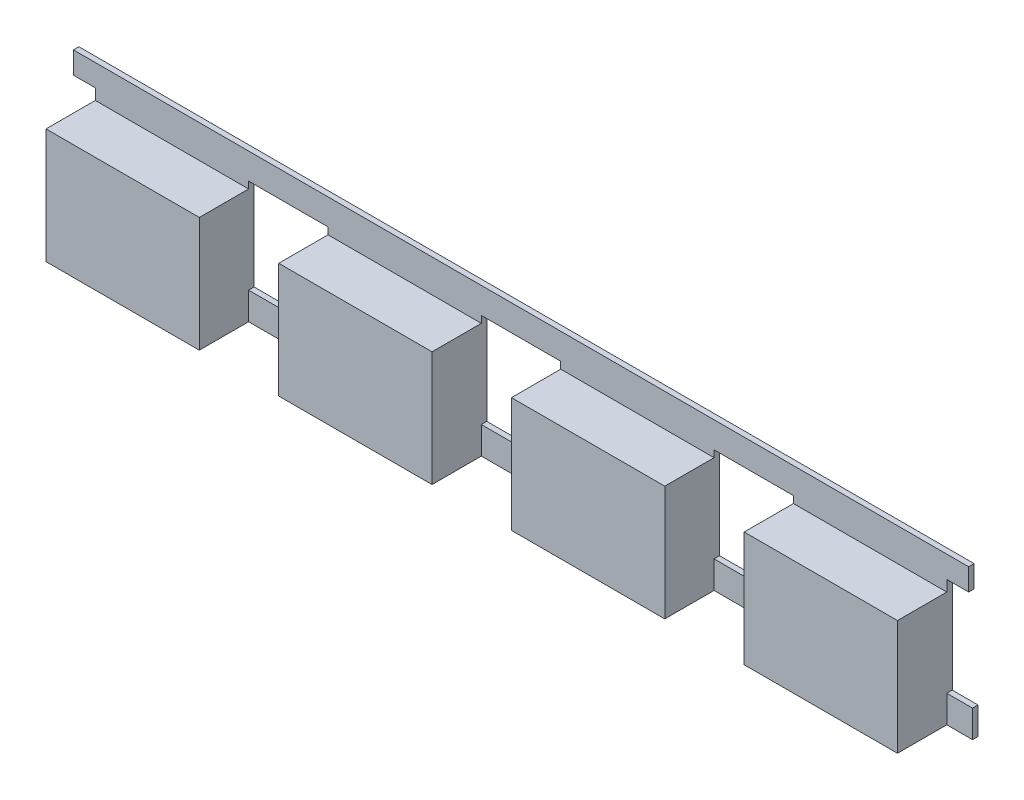
from build123d import *

# Parameters (mm, degrees)
SKETCH_1_W             = 5.6
SKETCH_1_H             = 4.2
EXTRUDE_1_DEPTH        = 1.4
SKETCH_3_W             = 31.1
SKETCH_3_H             = 1.5
EXTRUDE_2_DEPTH        = 0.2
PATTERN_LINEAR_1_COUNT = 4
PATTERN_LINEAR_1_PITCH = 8.5
SKETCH_4_W             = 2.9
SKETCH_4_H             = 1.1
CUT_EXTRUDE_1_DEPTH    = 0.2
SKETCH_5_W             = 0.2
SKETCH_5_H             = 0.8
EXTRUDE_3_DEPTH        = 0.8
SKETCH_6_W             = 0.2
SKETCH_6_H             = 0.8
EXTRUDE_4_DEPTH        = 0.8
SKETCH_7_W             = 32.884134448
SKETCH_7_H             = 1
EXTRUDE_5_DEPTH        = 0.2
CUT_EXTRUDE_START      = -1
SKETCH_8_W             = 4.4
SKETCH_8_H             = 3
CUT_EXTRUDE_2_DEPTH    = 1
SKETCH_9_W             = 5.6
SKETCH_9_H             = 4.2
EXTRUDE_6_DEPTH        = 0.6


with BuildPart() as part:
    # Эскиз1 → Бобышка-Вытянуть1 (new body)
    with BuildSketch(Plane.XY):
        Rectangle(SKETCH_1_W, SKETCH_1_H)
    extrude_1 = extrude(amount=EXTRUDE_1_DEPTH)

    # Эскиз3 → Бобышка-Вытянуть2 (add)
    with BuildSketch(Plane(origin=(0, 0, 0), x_dir=(-1, 0, 0), z_dir=(0, 0, -1))):
        with Locations((-12.75, 2.55)):
            Rectangle(SKETCH_3_W, SKETCH_3_H)
    extrude(amount=-EXTRUDE_2_DEPTH)

    # Линейный массив1: Бобышка-Вытянуть1 ×4
    with Locations(*[(i * PATTERN_LINEAR_1_PITCH, 0, 0) for i in range(1, PATTERN_LINEAR_1_COUNT)]):
        add(extrude_1)

    # Эскиз4 → Вырез-Вытянуть1 (cut)
    with BuildSketch(Plane(origin=(0, 0, 0), x_dir=(-1, 0, 0), z_dir=(0, 0, -1))):
        with Locations((-21.25, 1.8)):
            Rectangle(SKETCH_4_W, SKETCH_4_H)
        with Locations((-12.75, 1.8)):
            Rectangle(SKETCH_4_W, SKETCH_4_H)
        with Locations((-4.25, 1.8)):
            Rectangle(SKETCH_4_W, SKETCH_4_H)
    extrude(amount=-CUT_EXTRUDE_1_DEPTH, mode=Mode.SUBTRACT)

    # Эскиз5 → Бобышка-Вытянуть3 (add)
    with BuildSketch(Plane(origin=(28.3, 0, 0), x_dir=(0, 0, -1), z_dir=(1, 0, 0))):
        with Locations((-0.1, 2.9)):
            Rectangle(SKETCH_5_W, SKETCH_5_H)
    extrude(amount=EXTRUDE_3_DEPTH)

    # Эскиз6 → Бобышка-Вытянуть4 (add)
    with BuildSketch(Plane.ZY.offset(2.8)):
        with Locations((0.1, 2.9)):
            Rectangle(SKETCH_6_W, SKETCH_6_H)
    extrude(amount=EXTRUDE_4_DEPTH)

    # Эскиз7 → Бобышка-Вытянуть5 (add)
    with BuildSketch(Plane(origin=(0, 0, 0), x_dir=(-1, 0, 0), z_dir=(0, 0, -1))):
        with Locations((-12.798406479, -1.6)):
            Rectangle(SKETCH_7_W, SKETCH_7_H)
    extrude(amount=-EXTRUDE_5_DEPTH)

    # Эскиз8 → Вырез-Вытянуть2 (cut)
    with BuildSketch(Plane.XY.offset(1.4).offset(CUT_EXTRUDE_START)):
        Rectangle(SKETCH_8_W, SKETCH_8_H)
        with Locations((8.5, 0)):
            Rectangle(SKETCH_8_W, SKETCH_8_H)
        with Locations((17, 0)):
            Rectangle(SKETCH_8_W, SKETCH_8_H)
        with Locations((25.5, 0)):
            Rectangle(SKETCH_8_W, SKETCH_8_H)
    extrude(amount=-CUT_EXTRUDE_2_DEPTH, mode=Mode.SUBTRACT)

    # Эскиз9 → Бобышка-Вытянуть6 (add)
    with BuildSketch(Plane.XY.offset(1.4)):
        Rectangle(SKETCH_9_W, SKETCH_9_H)
        with Locations((8.5, 0)):
            Rectangle(SKETCH_9_W, SKETCH_9_H)
        with Locations((17, 0)):
            Rectangle(SKETCH_9_W, SKETCH_9_H)
        with Locations((25.5, 0)):
            Rectangle(SKETCH_9_W, SKETCH_9_H)
    extrude(amount=EXTRUDE_6_DEPTH)


solid = part.part
